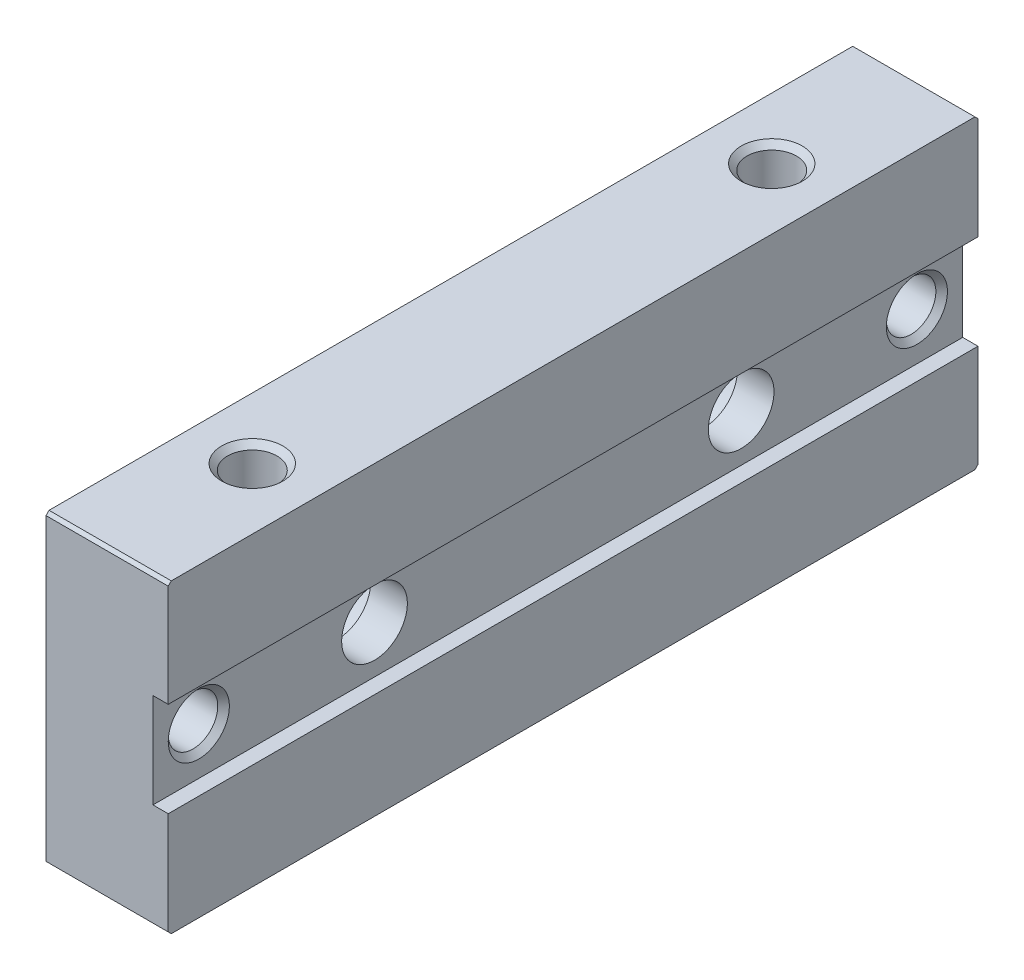
from build123d import *

# Parameters (mm, degrees)
EXTRUDE_1_DEPTH          = 8
CUT_EXTRUDE_1_DEPTH      = 54
CUT_EXTRUDE_1_DEPTH_BACK = 54
SKETCH_4_W               = 12.4
SKETCH_4_H               = 6.2


with BuildPart() as part:
    # 草图1 → 凸台-拉伸1 (new body)
    with BuildSketch(Plane(origin=(0, 0, 0), x_dir=(0, 0, -1), z_dir=(1, 0, 0))):
        Polygon((-26.5, 19.8), (-26.5, 0.2), (-26.3, 0), (26.3, 0), (26.5, 0.2), (26.5, 19.8), (26.3, 20), (-26.3, 20), align=None)
    extrude(amount=EXTRUDE_1_DEPTH)

    # 草图2 → 切除-旋转1 (revolve, cut)
    with BuildSketch(Plane.XY.offset(-17)):
        Polygon((4, 20), (6, 20), (5.621, 19.621), (5.621, 14), (4, 13.064115214), align=None)
    revolve(axis=Axis((4, 13.064115214, -17), (0, 1, 0)), mode=Mode.SUBTRACT)

    # 草图3 → 切除-旋转2 (revolve, cut)
    with BuildSketch(Plane.XY.offset(17)):
        Polygon((4, 20), (6, 20), (5.621, 19.621), (5.621, 14), (4, 13.064115214), align=None)
    revolve(axis=Axis((4, 13.064115214, 17), (0, 1, 0)), mode=Mode.SUBTRACT)

    # 草图4 → 切除-拉伸1 (cut, two sides: drawn at the far end of the back side and taken through both)
    with BuildSketch(Plane.XY.offset(-CUT_EXTRUDE_1_DEPTH_BACK)):
        with Locations((13.2, 10)):
            Rectangle(SKETCH_4_W, SKETCH_4_H)
    extrude(amount=CUT_EXTRUDE_1_DEPTH + CUT_EXTRUDE_1_DEPTH_BACK, mode=Mode.SUBTRACT)

    # 草图5 → 切除-旋转3 (revolve, cut)
    with BuildSketch(Plane.XY.offset(23.5)):
        Polygon((0, 10), (0, 12), (0.379, 11.621), (6.621, 11.621), (7, 12), (7, 10), align=None)
    revolve(axis=Axis((7, 10, 23.5), (-1, 0, 0)), mode=Mode.SUBTRACT)

    # 草图6 → 切除-旋转4 (revolve, cut)
    with BuildSketch(Plane.XY.offset(-23.5)):
        Polygon((0, 10), (0, 12), (0.379, 11.621), (6.621, 11.621), (7, 12), (7, 10), align=None)
    revolve(axis=Axis((7, 10, -23.5), (-1, 0, 0)), mode=Mode.SUBTRACT)

    # 草图7 → 切除-旋转5 (revolve, cut)
    with BuildSketch(Plane.XY.offset(12)):
        Polygon((0, 10), (0, 13.9), (4.6, 13.9), (4.6, 12.15), (7, 12.15), (7, 10), align=None)
    revolve(axis=Axis((7, 10, 12), (-1, 0, 0)), mode=Mode.SUBTRACT)

    # 草图8 → 切除-旋转6 (revolve, cut)
    with BuildSketch(Plane.XY.offset(-12)):
        Polygon((0, 10), (0, 13.9), (4.6, 13.9), (4.6, 12.15), (7, 12.15), (7, 10), align=None)
    revolve(axis=Axis((7, 10, -12), (-1, 0, 0)), mode=Mode.SUBTRACT)


solid = part.part
